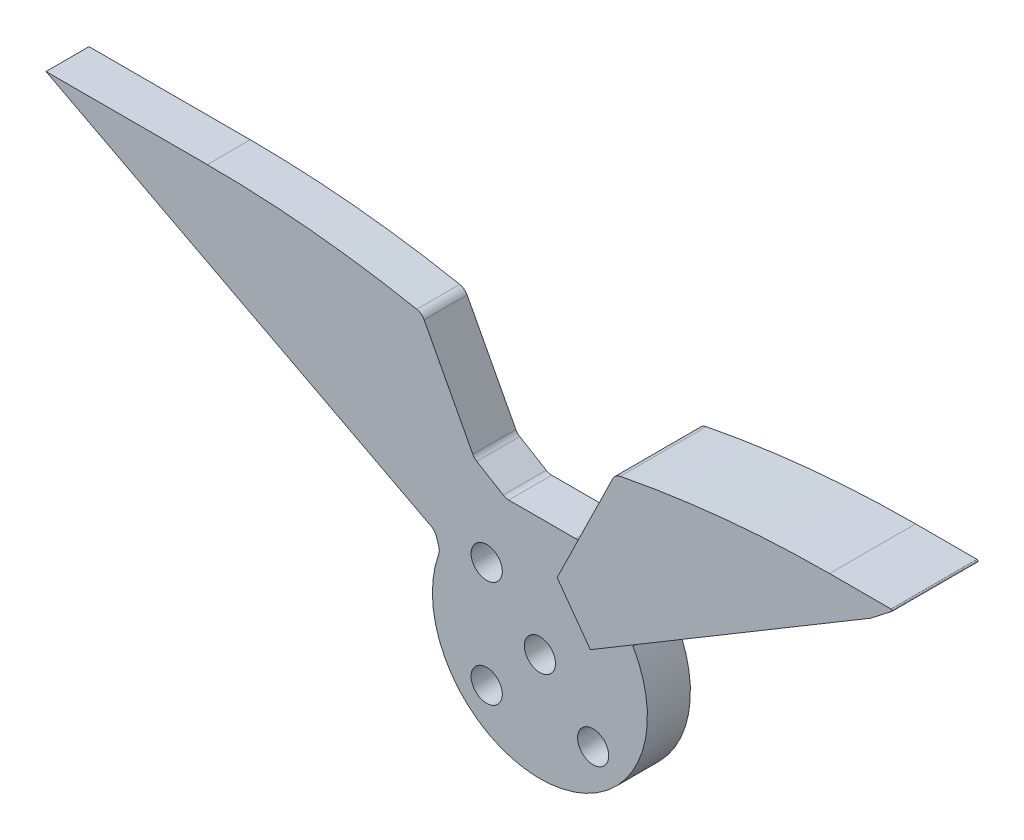
from build123d import *

# Parameters (mm, degrees)
SKETCH_1_R          = 10
EXTRUDE_1_DEPTH     = 4
EXTRUDE_3_DEPTH     = 4
SKETCH_4_R          = 1.45
CUT_EXTRUDE_1_DEPTH = 4
FILLET_5_R          = 0.5
CHAMFER_4_SIZE      = 1
EXTRUDE_START       = 4
EXTRUDE_4_DEPTH     = 4
CHAMFER_5_SIZE      = 2
CHAMFER_6_SIZE      = 1
FILLET_7_R          = 1
FILLET_8_R          = 1
FILLET_9_R          = 1
SKETCH_6_R          = 1.45
CUT_EXTRUDE_2_DEPTH = 10
FILLET_10_R         = 0.3
EXTRUDE_5_REACH     = 54.446
FILLET_11_R         = 0.1


with BuildPart() as part:
    # 草图1 → 凸台-拉伸1 (new body)
    with BuildSketch(Plane.XY):
        Circle(SKETCH_1_R)
    extrude(amount=EXTRUDE_1_DEPTH)

    # 草图3 → 凸台-拉伸3 (add)
    with BuildSketch(Plane.XY.offset(4)):
        with BuildLine():
            Line((-5.176881784364506, 11.000218871775912), (5.600807006130042, 11.000218871775912))
            Line((5.600807006130042, 11.000218871775912), (10.989651401377268, 22.000218871775843))
            ThreePointArc((10.989651401377268, 22.000218871775843), (20.91618080670068, 23.488479392998585), (30.94061356284172, 23.999999999999996))
            Line((30.94061356284172, 23.999999999999996), (0, 0))
            Line((0, 0), (-45.940613562841676, 24.00000000000002))
            Line((-45.940613562841676, 24.00000000000002), (-30.940613562841733, 23.999999999999996))
            ThreePointArc((-30.940613562841733, 23.999999999999996), (-20.916180806700666, 23.488479392998585), (-10.989651401377253, 22.000218871775836))
            Line((-10.989651401377253, 22.000218871775836), (-5.176881784364506, 11.000218871775912))
        make_face()
    extrude(amount=-EXTRUDE_3_DEPTH)

    # 草图4 → 切除-拉伸1 (cut)
    with BuildSketch(Plane(origin=(0, 0, 0), x_dir=(-1, 0, 0), z_dir=(0, 0, -1))):
        with Locations((-4.949747468305833, -4.949747468305833)):
            Circle(SKETCH_4_R)
        with Locations((-4.949747468305833, 4.949747468305833)):
            Circle(SKETCH_4_R)
        with Locations((4.949747468305833, 4.949747468305833)):
            Circle(SKETCH_4_R)
        with Locations((4.949747468305833, -4.949747468305833)):
            Circle(SKETCH_4_R)
    extrude(amount=-CUT_EXTRUDE_1_DEPTH, mode=Mode.SUBTRACT)

    # 圆角5
    fillet_5_edges = [part.edges().sort_by_distance(p)[0] for p in [
        (-3.4997474683058325, -4.949747468305833, 0),
        (-3.4997474683058325, 4.949747468305833, 0),
        (6.399747468305833, 4.949747468305833, 0),
        (6.399747468305833, -4.949747468305833, 0),
    ]]
    fillet(fillet_5_edges, radius=FILLET_5_R)

    # 倒角4
    # the kernel refuses this chamfer: 1 mm, written as the material it adds along each edge
    with BuildSketch(Plane(origin=(-8.863395681809687, 4.630358192157212, 4), x_dir=(-0.4155282844183179, -0.9095802575080274, 0), z_dir=(0, 0, -1))) as chamfer_4_piece_1:
        with BuildLine():
            Line((1.0573815899873193, -3e-17), (-CHAMFER_4_SIZE * 0.0528690794994, CHAMFER_4_SIZE * 0.998601452249))
            Line((-CHAMFER_4_SIZE * 0.0528690794994, CHAMFER_4_SIZE * 0.998601452249), (0, 0))
            ThreePointArc((0, 0), (0.5436016135552321, 0.01397436088292918), (1.0573815899873193, -3e-17))
        make_face()
    extrude(amount=4)
    with BuildSketch(Plane(origin=(7.901550123756916, 6.129070536529751, 4), x_dir=(0.5702751057051193, -0.8214537746051297, 0), z_dir=(0, 0, -1))) as chamfer_4_piece_2:
        with BuildLine():
            Line((1.0573815899873211, -5e-17), (-CHAMFER_4_SIZE * 0.0528690794994, -CHAMFER_4_SIZE * 0.998601452249))
            Line((-CHAMFER_4_SIZE * 0.0528690794994, -CHAMFER_4_SIZE * 0.998601452249), (0, 0))
            ThreePointArc((0, 0), (0.5436016135552315, -0.01397436088292837), (1.0573815899873211, -5e-17))
        make_face()
    extrude(amount=4)

    # 草图5 → 凸台-拉伸4 (add)
    with BuildSketch(Plane.XY.offset(4).offset(EXTRUDE_START)):
        with BuildLine():
            Line((10.989651401377264, 22.00021887177582), (5.600807006130042, 11.000218871775912))
            Line((5.600807006130042, 11.000218871775912), (8.691705136132603, 6.741977590182721))
            Line((8.691705136132603, 6.741977590182721), (30.94061356284172, 23.999999999999996))
            ThreePointArc((30.94061356284172, 23.999999999999996), (20.91618080670068, 23.488479392998585), (10.989651401377264, 22.00021887177582))
        make_face()
    extrude(amount=-EXTRUDE_4_DEPTH)

    # 倒角5
    chamfer_5_edges = [part.edges().sort_by_distance(p)[0] for p in [
        (-5.176881784364506, 11.000218871775912, 2),
        (5.600807006130042, 11.000218871775912, 2),
    ]]
    chamfer(chamfer_5_edges, length=CHAMFER_5_SIZE)

    # 倒角6
    chamfer_6_edges = [part.edges().sort_by_distance(p)[0] for p in [
        (7.146256071131322, 8.871098230979317, 4),
        (6.040746175985957, 11.898246447536525, 4),
    ]]
    chamfer(chamfer_6_edges, length=CHAMFER_6_SIZE)

    # 圆角7
    fillet_7_edges = [part.edges().sort_by_distance(p)[0] for p in [
        (6.480685345841874, 12.796274023297144, 2.5),
        (-3.1768817843645056, 11.00021887177591, 2),
        (3.60080700613004, 11.000218871775912, 2),
        (-6.111305934127264, 12.768509432837678, 2),
    ]]
    fillet(fillet_7_edges, radius=FILLET_7_R)

    # 圆角8
    fillet_8_edges = [part.edges().sort_by_distance(p)[0] for p in [
        (-10.989651401377252, 22.000218871775846, 2),
        (10.989651401377264, 22.000218871775836, 4),
    ]]
    fillet(fillet_8_edges, radius=FILLET_8_R)

    # 圆角9
    fillet_9_edges = [part.edges().sort_by_distance(p)[0] for p in [
        (8.504548521757462, 5.26048043823719, 2),
        (8.691705136132835, 6.741977590182982, 2.5),
        (-9.302767639872544, 3.6685847732522547, 2),
        (-9.749735249991502, 5.093394011372698, 2),
    ]]
    fillet(fillet_9_edges, radius=FILLET_9_R)

    # 草图6 → 切除-拉伸2 (cut)
    with BuildSketch(Plane(origin=(0, 0, 0), x_dir=(-1, 0, 0), z_dir=(0, 0, -1))):
        Circle(SKETCH_6_R)
    extrude(amount=-CUT_EXTRUDE_2_DEPTH, mode=Mode.SUBTRACT)

    # 圆角10
    fillet_10_edges = [part.edges().sort_by_distance(p)[0] for p in [
        (1.45, 1.8e-16, 0),
    ]]
    fillet(fillet_10_edges, radius=FILLET_10_R)

    # 凸台-拉伸5: up to this face of the body (flat: up to its plane)
    extrude_5_end = Plane(part.part.faces().sort_by_distance((-5.497293507, 11.434254101, 0))[0])
    # 草图7 → 凸台-拉伸5 (add, up to the picked face)
    with BuildSketch(Plane.XY.offset(8), mode=Mode.PRIVATE) as extrude_5_sk1:
        Polygon((30.94061356284172, 23.999999999999996), (36.94061356284172, 23.999999999999993), (34.761147405505504, 22.309432756728267), (8.691705136132603, 6.741977590182721), (28.761147405505504, 22.30943275672827), align=None)
    extrude_5_tool1 = split(extrude(extrude_5_sk1.sketch, amount=-EXTRUDE_5_REACH, mode=Mode.PRIVATE), bisect_by=extrude_5_end, keep=Keep.BOTH, mode=Mode.PRIVATE)
    add(extrude_5_tool1.solids().sort_by(Axis((25.637932, 18.197049, 8), (0, 0, -1)))[0])

    # 圆角11
    fillet_11_edges = [part.edges().sort_by_distance(p)[0] for p in [
        (36.94061356284172, 23.999999999999993, 4),
    ]]
    fillet(fillet_11_edges, radius=FILLET_11_R)


solid = part.part
